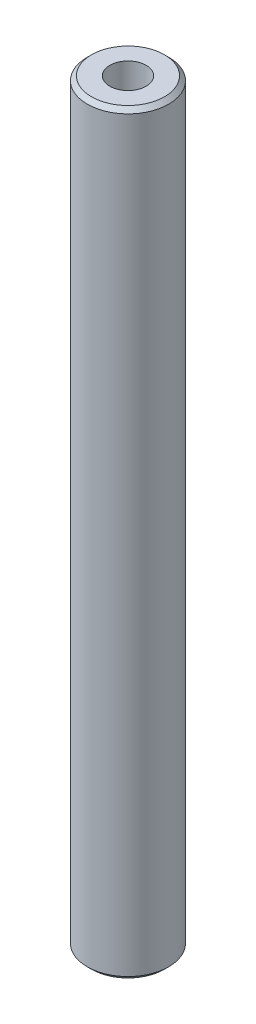
from build123d import *

# Parameters (mm, degrees)
SKETCH1_R           = 7.5
BOSS_EXTRUDE1_DEPTH = 139.2004937
SKETCH2_R           = 3.348630386
CUT_EXTRUDE1_DEPTH  = 140.604002258
CHAMFER1_SIZE       = 0.782384835


with BuildPart() as part:
    # Sketch1 → Boss-Extrude1 (new body)
    with BuildSketch(Plane(origin=(0, 0, 0), x_dir=(1, 0, 0), z_dir=(0, 1, 0))):
        Circle(SKETCH1_R)
    extrude(amount=BOSS_EXTRUDE1_DEPTH)

    # Sketch2 → Cut-Extrude1 (cut, through all)
    with BuildSketch(Plane(origin=(0, 0, 0), x_dir=(1, 0, 0), z_dir=(0, 1, 0))):
        Circle(SKETCH2_R)
    extrude(amount=CUT_EXTRUDE1_DEPTH, mode=Mode.SUBTRACT)

    # Chamfer1
    chamfer1_edges = [part.edges().sort_by_distance(p)[0] for p in [
        (-7.5, 139.2004937, 0),
        (-7.5, 0, 0),
    ]]
    chamfer(chamfer1_edges, length=CHAMFER1_SIZE)


solid = part.part
